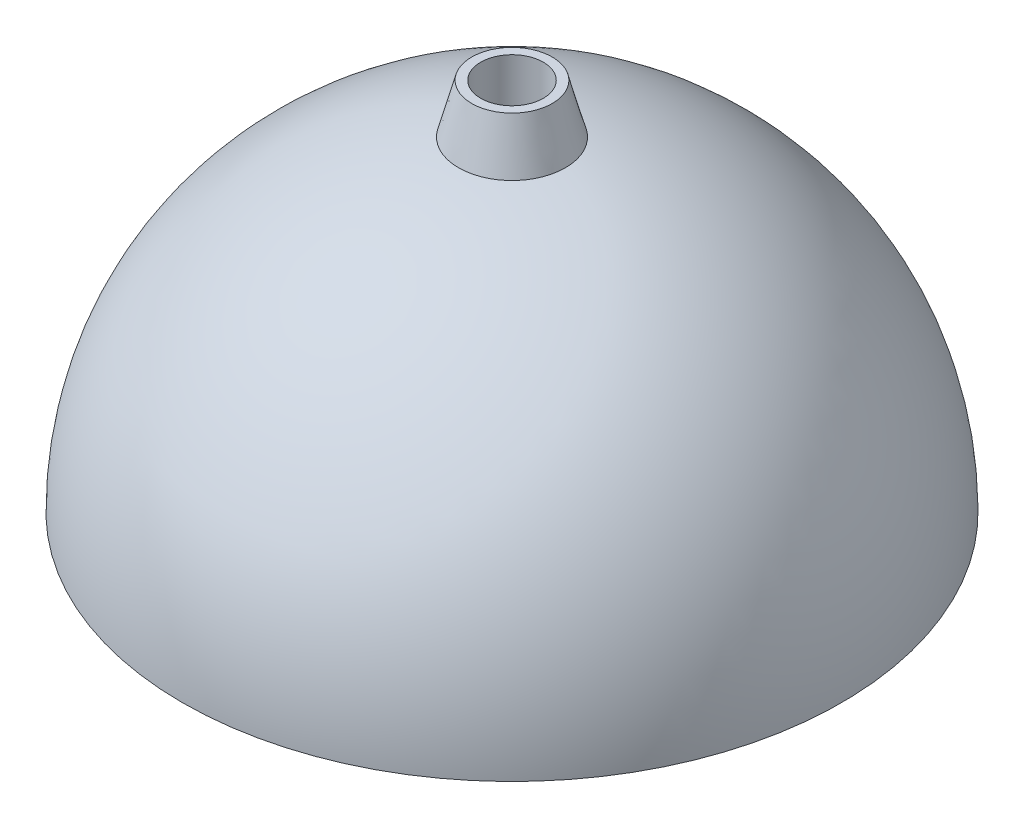
from build123d import *

# Parameters (mm, degrees)
SKETCH3_R                = 50.8
CUT_EXTRUDE1_DEPTH       = 35
FILLET1_R                = 15
SKETCH5_R                = 7
GSM_ANTENNA_DEPTH        = 133.362935901
SKETCH9_R                = 1.75
CUT_EXTRUDE6_DEPTH       = 10
CIRPATTERN1_COUNT        = 10
BOSS_EXTRUDE2_REACH      = 135.606
BOSS_EXTRUDE2_END_RADIUS = 73.66
SKETCH13_R               = 9
SKETCH13_R_2             = 7
DRAFT2_ANGLE             = 15


with BuildPart() as part:
    # Sketch2 → Dome (revolve)
    with BuildSketch(Plane.XY):
        with BuildLine():
            Line((0, 73.66), (0, 0))
            Line((0, 0), (73.66, 0))
            ThreePointArc((73.66, 0), (52.085485502, 52.085485502), (0, 73.66))
        make_face()
    revolve(axis=Axis((0, 73.66, 0), (0, -1, 0)))

    # Sketch3 → Cut-Extrude1 (cut)
    with BuildSketch(Plane.XZ):
        Circle(SKETCH3_R)
    extrude(amount=-CUT_EXTRUDE1_DEPTH, mode=Mode.SUBTRACT)

    # Sketch4 → Wall Shape (revolve, cut)
    with BuildSketch(Plane.XY):
        with BuildLine():
            Line((-50.8, 5), (-50.8, 0))
            Line((-50.8, 0), (0, 0))
            Line((0, 0), (0, 70.66))
            ThreePointArc((0, 70.66), (-36.285571477, 60.631616361), (-62.271521348, 33.393011678))
            Line((-62.271521348, 33.393011678), (-50.8, 5))
        make_face()
    revolve(axis=Axis((0, 0, 0), (0, 1, 0)), mode=Mode.SUBTRACT)

    # Fillet1
    fillet1_edges = [part.edges().sort_by_distance(p)[0] for p in [
        (62.271521348, 33.393011678, 0),
    ]]
    fillet(fillet1_edges, radius=FILLET1_R)

    # Sketch5 → GSM Antenna (cut, through all)
    with BuildSketch(Plane(origin=(0, -8.000000002, 0), x_dir=(1, 0, 0), z_dir=(0, 1, 0))):
        Circle(SKETCH5_R)
    extrude(amount=GSM_ANTENNA_DEPTH, mode=Mode.SUBTRACT)

    # Sketch9 → Cut-Extrude6 (cut)
    with BuildSketch(Plane(origin=(0, 0, 0), x_dir=(-1, 0, 0), z_dir=(0, -1, 0))):
        with Locations((0, -67.5)):
            Circle(SKETCH9_R)
    cut_extrude6 = extrude(amount=-CUT_EXTRUDE6_DEPTH, mode=Mode.SUBTRACT)

    # CirPattern1: Cut-Extrude6 ×10 about axis
    cirpattern1_axis = Axis((0, 35, 0), (0, -1, 0))
    for i in range(1, CIRPATTERN1_COUNT):
        add(cut_extrude6.rotate(cirpattern1_axis, i * 360 / CIRPATTERN1_COUNT), mode=Mode.SUBTRACT)

    # Boss-Extrude2: up to this sphere (the profile starts outside it)
    boss_extrude2_end = Location((0, 0, 0)) * Sphere(BOSS_EXTRUDE2_END_RADIUS, mode=Mode.PRIVATE)
    # Sketch13 → Boss-Extrude2 (add, up to the surface)
    with BuildSketch(Plane(origin=(0, 83.66, 0), x_dir=(1, 0, 0), z_dir=(0, 1, 0)), mode=Mode.PRIVATE) as boss_extrude2_sk1:
        Circle(SKETCH13_R)
        Circle(SKETCH13_R_2, mode=Mode.SUBTRACT)
    boss_extrude2_tool1 = extrude(boss_extrude2_sk1.sketch, amount=-BOSS_EXTRUDE2_REACH, mode=Mode.PRIVATE) - boss_extrude2_end
    add(boss_extrude2_tool1.solids().sort_by_distance((-8.745442, 83.66, 0))[0])

    # Draft2
    draft2_faces = [part.faces().sort_by_distance(p)[0] for p in [
        (-9, 78.384054495, 0),
    ]]
    draft(draft2_faces, Plane.ZX.offset(83.66), DRAFT2_ANGLE)


solid = part.part
